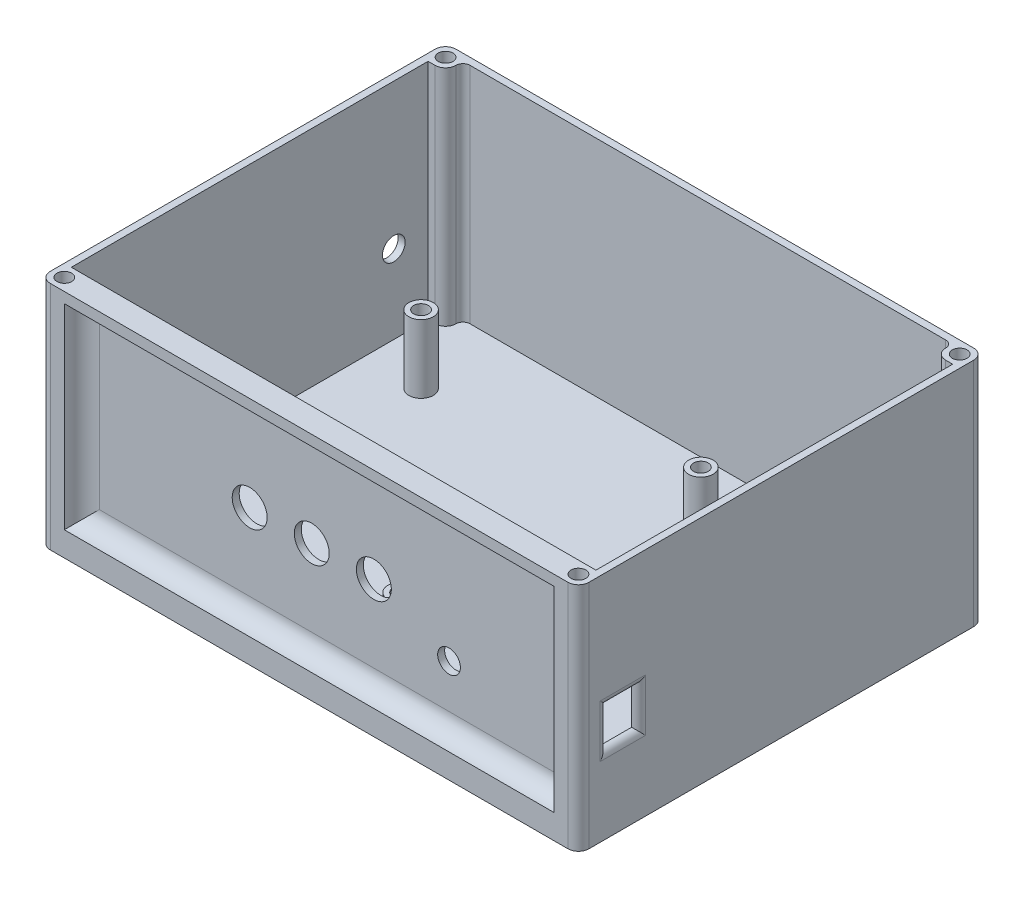
from build123d import *

# Parameters (mm, degrees)
SKETCH1_W           = 154
SKETCH1_H           = 116
BOSS_EXTRUDE1_DEPTH = 70
SKETCH2_W           = 150
SKETCH2_H           = 102
CUT_EXTRUDE1_DEPTH  = 68
SKETCH3_W           = 140
SKETCH3_H           = 5
CUT_EXTRUDE2_DEPTH  = 68
SKETCH5_W           = 70
SKETCH5_H           = 56
CUT_EXTRUDE4_DEPTH  = 5
SKETCH17_W          = 9
SKETCH17_H          = 11
CUT_EXTRUDE12_DEPTH = 178.110135227
FILLET1_R           = 2
FILLET3_R           = 5
FILLET4_R           = 3
FILLET5_R           = 3
FILLET6_R           = 3
FILLET7_R           = 3
FILLET9_R           = 3
FILLET11_R          = 2
FILLET12_R          = 3
FILLET13_R          = 2
SKETCH18_W          = 154
SKETCH18_H          = 116
CUT_EXTRUDE13_DEPTH = 4
SKETCH19_R          = 5
CUT_EXTRUDE14_DEPTH = 4
SKETCH20_R          = 3.5
BOSS_EXTRUDE3_DEPTH = 19.5
SKETCH22_R          = 3.5
BOSS_EXTRUDE4_DEPTH = 18
SKETCH24_R          = 3.25
CUT_EXTRUDE17_DEPTH = 149.882504009
SKETCH25_R          = 3.25
CUT_EXTRUDE18_DEPTH = 176.567650779
SKETCH6_R           = 1.5
CUT_EXTRUDE19_DEPTH = 60
SKETCH26_R          = 2.1
CUT_EXTRUDE20_DEPTH = 10
SKETCH23_R          = 1.5
CUT_EXTRUDE21_DEPTH = 15
SKETCH27_R          = 2.1
CUT_EXTRUDE22_DEPTH = 10
SKETCH21_R          = 1.5
CUT_EXTRUDE23_DEPTH = 15
SKETCH28_R          = 2.1
CUT_EXTRUDE24_DEPTH = 10


with BuildPart() as part:
    # Sketch1 → Boss-Extrude1 (new body)
    with BuildSketch(Plane(origin=(0, 0, 0), x_dir=(1, 0, 0), z_dir=(0, 1, 0))):
        Rectangle(SKETCH1_W, SKETCH1_H)
    extrude(amount=BOSS_EXTRUDE1_DEPTH)

    # Sketch2 → Cut-Extrude1 (cut)
    with BuildSketch(Plane(origin=(0, 70, 0), x_dir=(1, 0, 0), z_dir=(0, 1, 0))):
        Rectangle(SKETCH2_W, SKETCH2_H)
    extrude(amount=-CUT_EXTRUDE1_DEPTH, mode=Mode.SUBTRACT)

    # Sketch3 → Cut-Extrude2 (cut)
    with BuildSketch(Plane(origin=(0, 70, 0), x_dir=(1, 0, 0), z_dir=(0, 1, 0))):
        with Locations((0, 53.5)):
            Rectangle(SKETCH3_W, SKETCH3_H)
    extrude(amount=-CUT_EXTRUDE2_DEPTH, mode=Mode.SUBTRACT)

    # Sketch5 → Cut-Extrude4 (cut)
    with BuildSketch(Plane.XY.offset(58)):
        with Locations((35, 35)):
            Rectangle(SKETCH5_W, SKETCH5_H)
        with Locations((-35, 35)):
            Rectangle(SKETCH5_W, SKETCH5_H)
    extrude(amount=-CUT_EXTRUDE4_DEPTH, mode=Mode.SUBTRACT)

    # Sketch17 → Cut-Extrude12 (cut, through all)
    with BuildSketch(Plane.ZY.offset(-75)):
        with Locations((45.3, 27.5)):
            Rectangle(SKETCH17_W, SKETCH17_H)
    extrude(amount=-CUT_EXTRUDE12_DEPTH, mode=Mode.SUBTRACT)

    # Fillet1
    fillet1_edges = [part.edges().sort_by_distance(p)[0] for p in [
        (77, 27.5, 49.8),
        (77, 22, 45.3),
        (77, 27.5, 40.8),
        (77, 33, 45.3),
    ]]
    fillet(fillet1_edges, radius=FILLET1_R - 0.0001)  # a hair under: the kernel refuses the full size

    # Fillet3
    fillet3_edges = [part.edges().sort_by_distance(p)[0] for p in [
        (0, 7, 53),
        (70, 35, 53),
        (-70, 35, 53),
        (0, 63, 53),
    ]]
    fillet(fillet3_edges, radius=FILLET3_R - 0.0001)  # a hair under: the kernel refuses the full size

    # Fillet4
    fillet4_edges = [part.edges().sort_by_distance(p)[0] for p in [
        (77, 35, 58),
    ]]
    fillet(fillet4_edges, radius=FILLET4_R)

    # Fillet5
    fillet5_edges = [part.edges().sort_by_distance(p)[0] for p in [
        (-77, 35, 58),
    ]]
    fillet(fillet5_edges, radius=FILLET5_R)

    # Fillet6
    fillet6_edges = [part.edges().sort_by_distance(p)[0] for p in [
        (-77, 35, -58),
    ]]
    fillet(fillet6_edges, radius=FILLET6_R)

    # Fillet7
    fillet7_edges = [part.edges().sort_by_distance(p)[0] for p in [
        (77, 35, -58),
    ]]
    fillet(fillet7_edges, radius=FILLET7_R)

    # Fillet9
    fillet9_edges = [part.edges().sort_by_distance(p)[0] for p in [
        (-70, 36, -51),
    ]]
    fillet(fillet9_edges, radius=FILLET9_R)

    # Fillet11
    fillet11_edges = [part.edges().sort_by_distance(p)[0] for p in [
        (-70, 36, -56),
    ]]
    fillet(fillet11_edges, radius=FILLET11_R - 0.0001)  # a hair under: the kernel refuses the full size

    # Fillet12
    fillet12_edges = [part.edges().sort_by_distance(p)[0] for p in [
        (70, 36, -51),
    ]]
    fillet(fillet12_edges, radius=FILLET12_R)

    # Fillet13
    fillet13_edges = [part.edges().sort_by_distance(p)[0] for p in [
        (70, 36, -56),
    ]]
    fillet(fillet13_edges, radius=FILLET13_R - 0.0001)  # a hair under: the kernel refuses the full size

    # Sketch18 → Cut-Extrude13 (cut)
    with BuildSketch(Plane(origin=(0, 70, 0), x_dir=(1, 0, 0), z_dir=(0, 1, 0))):
        Rectangle(SKETCH18_W, SKETCH18_H)
    extrude(amount=-CUT_EXTRUDE13_DEPTH, mode=Mode.SUBTRACT)

    # Sketch19 → Cut-Extrude14 (cut)
    with BuildSketch(Plane(origin=(0, 0, 51), x_dir=(-1, 0, 0), z_dir=(0, 0, -1))):
        with Locations((-13.5, 34)):
            Circle(SKETCH19_R)
        with Locations((4.25, 34)):
            Circle(SKETCH19_R)
        with Locations((22, 34)):
            Circle(SKETCH19_R)
    extrude(amount=-CUT_EXTRUDE14_DEPTH, mode=Mode.SUBTRACT)

    # Sketch20 → Boss-Extrude3 (add)
    with BuildSketch(Plane(origin=(0, 2, 0), x_dir=(1, 0, 0), z_dir=(0, 1, 0))):
        with Locations(Location((-60, -36, 0), (0, 0, 270))):
            Circle(SKETCH20_R)
        with Locations(Location((8, -40, 0), (0, 0, 270))):
            Circle(SKETCH20_R)
        with Locations(Location((-59, 33, 0), (0, 0, 270))):
            Circle(SKETCH20_R)
        with Locations(Location((20, 34, 0), (0, 0, 270))):
            Circle(SKETCH20_R)
    extrude(amount=BOSS_EXTRUDE3_DEPTH)

    # Sketch22 → Boss-Extrude4 (add)
    with BuildSketch(Plane(origin=(0, 2, 0), x_dir=(1, 0, 0), z_dir=(0, 1, 0))):
        with Locations(Location((50, 29, 0), (0, 0, 270))):
            Circle(SKETCH22_R)
        with Locations(Location((35, 3, 0), (0, 0, 270))):
            Circle(SKETCH22_R)
        with Locations(Location((67, 3, 0), (0, 0, 270))):
            Circle(SKETCH22_R)
        with Locations(Location((54, -44, 0), (0, 0, 270))):
            Circle(SKETCH22_R)
    extrude(amount=BOSS_EXTRUDE4_DEPTH)

    # Sketch24 → Cut-Extrude17 (cut, through all)
    with BuildSketch(Plane(origin=(0, 0, 51), x_dir=(-1, 0, 0), z_dir=(0, 0, -1))):
        with Locations((-35, 24.5)):
            Circle(SKETCH24_R)
    extrude(amount=-CUT_EXTRUDE17_DEPTH, mode=Mode.SUBTRACT)

    # Sketch25 → Cut-Extrude18 (cut, through all)
    with BuildSketch(Plane(origin=(-75, 0, 0), x_dir=(0, 0, -1), z_dir=(1, 0, 0))):
        with Locations((-44, 24.5)):
            Circle(SKETCH25_R)
        with Locations((41.2, 24.5)):
            Circle(SKETCH25_R)
    extrude(amount=-CUT_EXTRUDE18_DEPTH, mode=Mode.SUBTRACT)

    # Sketch6 → Cut-Extrude19 (cut)
    with BuildSketch(Plane(origin=(0, 70, 0), x_dir=(1, 0, 0), z_dir=(0, 1, 0))):
        with Locations(Location((73.5, 54.5, 0), (0, 0, 270))):
            Circle(SKETCH6_R)
        with Locations(Location((-73.5, 54.5, 0), (0, 0, 270))):
            Circle(SKETCH6_R)
        with Locations(Location((73.5, -54.5, 0), (0, 0, 270))):
            Circle(SKETCH6_R)
        with Locations(Location((-73.5, -54.5, 0), (0, 0, 270))):
            Circle(SKETCH6_R)
    extrude(amount=-CUT_EXTRUDE19_DEPTH, mode=Mode.SUBTRACT)

    # Sketch26 → Cut-Extrude20 (cut)
    with BuildSketch(Plane(origin=(0, 66, 0), x_dir=(1, 0, 0), z_dir=(0, 1, 0))):
        with Locations(Location((73.5, -54.5, 0), (0, 0, 270))):
            Circle(SKETCH26_R)
        with Locations(Location((73.5, 54.5, 0), (0, 0, 270))):
            Circle(SKETCH26_R)
        with Locations(Location((-73.5, 54.5, 0), (0, 0, 270))):
            Circle(SKETCH26_R)
        with Locations(Location((-73.5, -54.5, 0), (0, 0, 270))):
            Circle(SKETCH26_R)
    extrude(amount=-CUT_EXTRUDE20_DEPTH, mode=Mode.SUBTRACT)

    # Sketch23 → Cut-Extrude21 (cut)
    with BuildSketch(Plane(origin=(0, 20, 0), x_dir=(1, 0, 0), z_dir=(0, 1, 0))):
        with Locations(Location((35, 3, 0), (0, 0, 270))):
            Circle(SKETCH23_R)
        with Locations(Location((50, 29, 0), (0, 0, 270))):
            Circle(SKETCH23_R)
        with Locations(Location((67, 3, 0), (0, 0, 270))):
            Circle(SKETCH23_R)
        with Locations(Location((54, -44, 0), (0, 0, 270))):
            Circle(SKETCH23_R)
    extrude(amount=-CUT_EXTRUDE21_DEPTH, mode=Mode.SUBTRACT)

    # Sketch27 → Cut-Extrude22 (cut)
    with BuildSketch(Plane(origin=(0, 20, 0), x_dir=(1, 0, 0), z_dir=(0, 1, 0))):
        with Locations(Location((54, -44, 0), (0, 0, 270))):
            Circle(SKETCH27_R)
        with Locations(Location((35, 3, 0), (0, 0, 270))):
            Circle(SKETCH27_R)
        with Locations(Location((50, 29, 0), (0, 0, 270))):
            Circle(SKETCH27_R)
        with Locations(Location((67, 3, 0), (0, 0, 270))):
            Circle(SKETCH27_R)
    extrude(amount=-CUT_EXTRUDE22_DEPTH, mode=Mode.SUBTRACT)

    # Sketch21 → Cut-Extrude23 (cut)
    with BuildSketch(Plane(origin=(0, 21.5, 0), x_dir=(1, 0, 0), z_dir=(0, 1, 0))):
        with Locations(Location((-59, 33, 0), (0, 0, 270))):
            Circle(SKETCH21_R)
        with Locations(Location((20, 34, 0), (0, 0, 270))):
            Circle(SKETCH21_R)
        with Locations(Location((8, -40, 0), (0, 0, 270))):
            Circle(SKETCH21_R)
        with Locations(Location((-60, -36, 0), (0, 0, 270))):
            Circle(SKETCH21_R)
    extrude(amount=-CUT_EXTRUDE23_DEPTH, mode=Mode.SUBTRACT)

    # Sketch28 → Cut-Extrude24 (cut)
    with BuildSketch(Plane(origin=(0, 21.5, 0), x_dir=(1, 0, 0), z_dir=(0, 1, 0))):
        with Locations(Location((-59, 33, 0), (0, 0, 270))):
            Circle(SKETCH28_R)
        with Locations(Location((-60, -36, 0), (0, 0, 270))):
            Circle(SKETCH28_R)
        with Locations(Location((8, -40, 0), (0, 0, 270))):
            Circle(SKETCH28_R)
        with Locations(Location((20, 34, 0), (0, 0, 270))):
            Circle(SKETCH28_R)
    extrude(amount=-CUT_EXTRUDE24_DEPTH, mode=Mode.SUBTRACT)


solid = part.part
